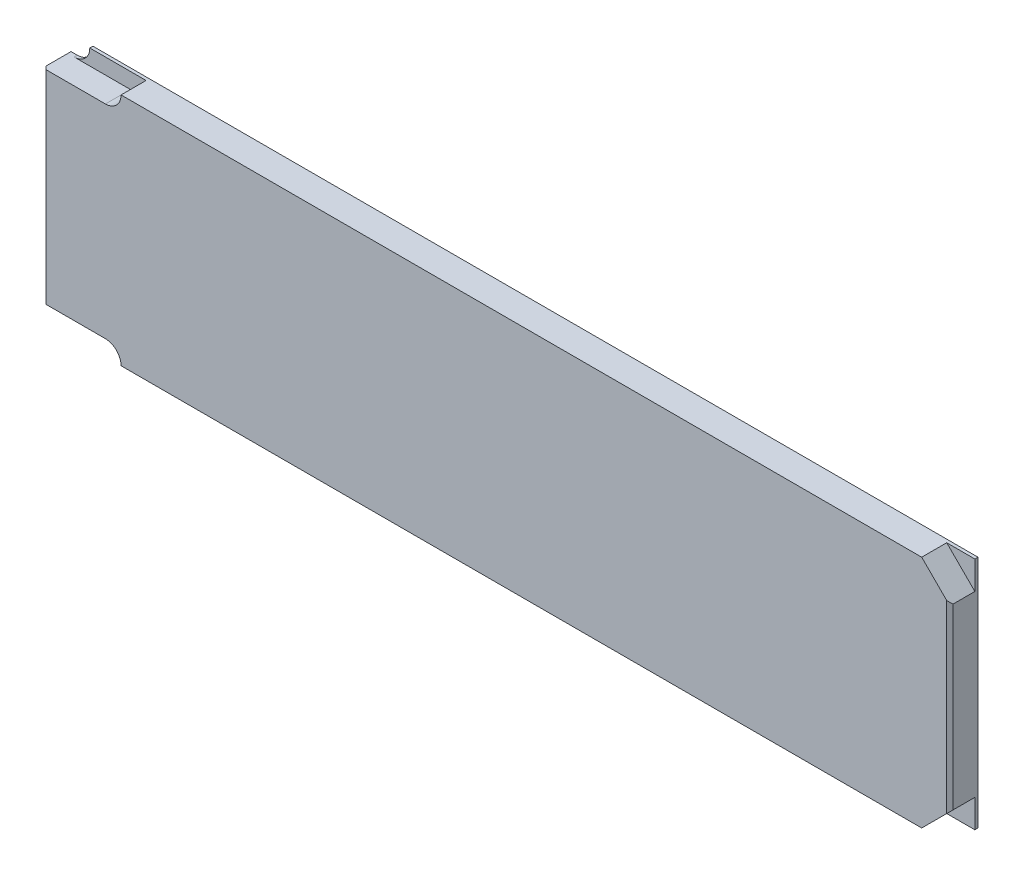
from build123d import *

# Parameters (mm, degrees)
BASE_EXTRUDE_DEPTH = 9
SKETCH2_W          = 25
SKETCH2_H          = 5
CUT_EXTRUDE1_DEPTH = 8
CHAMFER1_SIZE      = 1
FILLET1_R          = 5


with BuildPart() as part:
    # Sketch1 → Base-Extrude (new body)
    with BuildSketch(Plane.XY):
        Polygon((7, 0), (7, 5), (0, 5), (0, 70), (7, 70), (7, 75), (290, 75), (290, 0), align=None)
    extrude(amount=BASE_EXTRUDE_DEPTH)

    # Sketch2 → Cut-Extrude1 (cut)
    with BuildSketch(Plane.XY.offset(9)):
        Polygon((281, 75), (290, 66), (290, 75), align=None)
        Polygon((290, 9), (281, 0), (290, 0), align=None)
        with Locations((12.5, 72.5)):
            Rectangle(SKETCH2_W, SKETCH2_H)
        with Locations((12.5, 2.5)):
            Rectangle(SKETCH2_W, SKETCH2_H)
    extrude(amount=-CUT_EXTRUDE1_DEPTH, mode=Mode.SUBTRACT)

    # Chamfer1
    chamfer1_edges = [part.edges().sort_by_distance(p)[0] for p in [
        (0, 37.5, 9),
        (290, 37.5, 9),
    ]]
    chamfer(chamfer1_edges, length=CHAMFER1_SIZE)

    # Fillet1
    fillet1_edges = [part.edges().sort_by_distance(p)[0] for p in [
        (7, 5, 0.5),
        (25, 5, 5),
        (7, 70, 0.5),
        (25, 70, 5),
    ]]
    fillet(fillet1_edges, radius=FILLET1_R - 0.0001)  # a hair under: the kernel refuses the full size


solid = part.part
